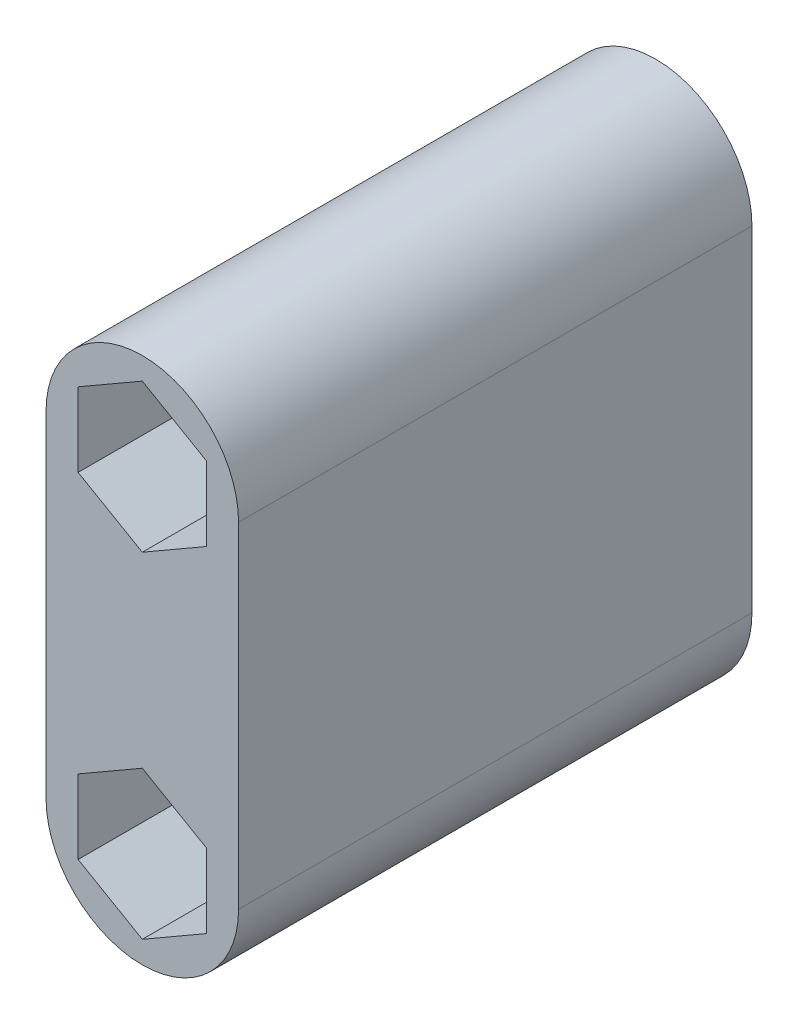
from build123d import *

# Parameters (mm, degrees)
BOSS_EXTRUDE1_DEPTH = 25.4
CUT_EXTRUDE1_DEPTH  = 34.520268465


with BuildPart() as part:
    # Sketch1 → Boss-Extrude1 (new body)
    with BuildSketch(Plane.XY):
        with BuildLine():
            Line((-4.7625, 0), (-4.7625, 16.5862))
            ThreePointArc((-4.7625, 16.5862), (0, 21.3487), (4.7625, 16.5862))
            Line((4.7625, 16.5862), (4.7625, 0))
            ThreePointArc((4.7625, 0), (0, -4.7625), (-4.7625, 0))
        make_face()
    extrude(amount=BOSS_EXTRUDE1_DEPTH)

    # Sketch2 → Cut-Extrude1 (cut, through all)
    with BuildSketch(Plane.XY.offset(25.4)):
        Polygon((0, 20.252374209), (-3.175, 18.419287105), (-3.175, 14.753112895), (0, 12.920025791), (3.175, 14.753112895), (3.175, 18.419287105), align=None)
        Polygon((0, 3.666174209), (-3.175, 1.833087105), (-3.175, -1.833087105), (0, -3.666174209), (3.175, -1.833087105), (3.175, 1.833087105), align=None)
    extrude(amount=-CUT_EXTRUDE1_DEPTH, mode=Mode.SUBTRACT)


solid = part.part
